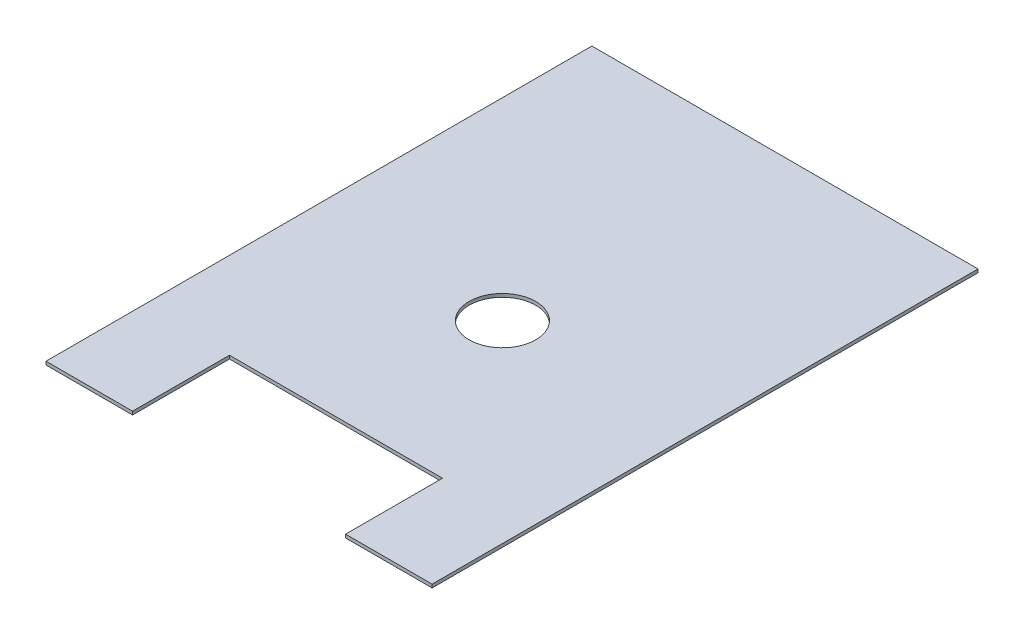
from build123d import *

# Parameters (mm, degrees)
SKETCH1_W          = 368.3
SKETCH1_H          = 520.7
BASE_FLANGE1_DEPTH = 3.175
SKETCH6_W          = 203.2
SKETCH6_H          = 184.912
CUT_EXTRUDE1_DEPTH = 319.909745265
SKETCH7_R          = 31.75
CUT_EXTRUDE2_DEPTH = 319.909745265


# Sheet-metal steps are written as plain solids
with BuildPart() as part:
    # Sketch1 → Base-Flange1 (new body)
    with BuildSketch(Plane(origin=(0, 0, 0), x_dir=(1, 0, 0), z_dir=(0, 1, 0))):
        Rectangle(SKETCH1_W, SKETCH1_H)
    extrude(amount=-BASE_FLANGE1_DEPTH)

    # Sketch6 → Cut-Extrude1 (cut, through all)
    with BuildSketch(Plane(origin=(0, 0, 0), x_dir=(1, 0, 0), z_dir=(0, 1, 0))):
        with Locations((0, -260.35)):
            Rectangle(SKETCH6_W, SKETCH6_H)
    extrude(amount=-CUT_EXTRUDE1_DEPTH, mode=Mode.SUBTRACT)

    # Sketch7 → Cut-Extrude2 (cut, through all)
    with BuildSketch(Plane(origin=(0, 0, 0), x_dir=(1, 0, 0), z_dir=(0, 1, 0))):
        with Locations(Location((0, -9.144, 0), (0, 0, 270))):
            Circle(SKETCH7_R)
    extrude(amount=-CUT_EXTRUDE2_DEPTH, mode=Mode.SUBTRACT)


solid = part.part
